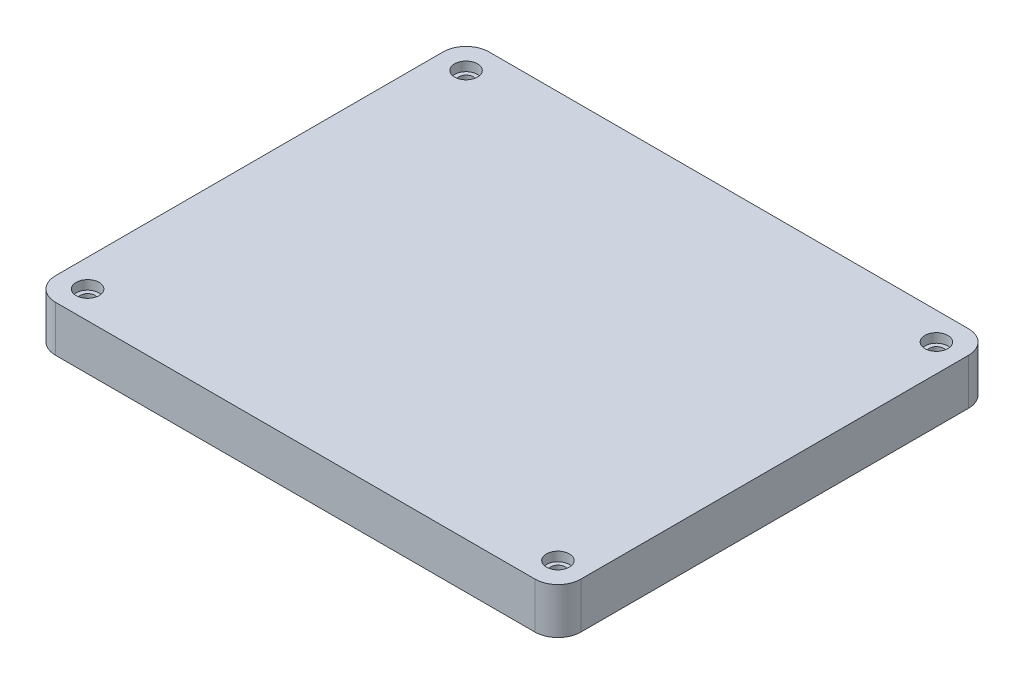
from build123d import *

# Parameters (mm, degrees)
SKETCH1_W            = 114.4
SKETCH1_H            = 94.4
BOSS_EXTRUDE1_DEPTH  = 10
SHELL2_T             = -2
FILLET3_R            = 5
FILLET4_R            = 5
SKETCH5_R            = 4
BOSS_EXTRUDE12_DEPTH = 8
FILLET5_R            = 5
FILLET6_R            = 5
FILLET7_R            = 5
FILLET8_R            = 5
FILLET9_R            = 5
FILLET10_R           = 5
FILLET11_DEPTH       = 9
FILLET12_DEPTH       = 9
SKETCH6_R            = 1.6
CUT_EXTRUDE1_DEPTH   = 10
SKETCH7_R            = 4
BOSS_EXTRUDE13_DEPTH = 10
SKETCH8_R            = 1.5
CUT_EXTRUDE2_DEPTH   = 8
SKETCH9_R            = 2.5
CUT_EXTRUDE3_DEPTH   = 2


with BuildPart() as part:
    # Sketch1 → Boss-Extrude1 (new body)
    with BuildSketch(Plane(origin=(0, 0, 0), x_dir=(1, 0, 0), z_dir=(0, 1, 0))):
        with Locations((57.2, 47.2)):
            Rectangle(SKETCH1_W, SKETCH1_H)
    extrude(amount=BOSS_EXTRUDE1_DEPTH)

    # Shell2
    shell2_openings = [part.faces().sort_by_distance(p)[0] for p in [
        (57.2, 0, -47.2),
    ]]
    offset(amount=SHELL2_T, openings=shell2_openings, kind=Kind.INTERSECTION)

    # Fillet3
    fillet3_edges = [part.edges().sort_by_distance(p)[0] for p in [
        (0, 5, -94.4),
        (114.4, 5, -94.4),
        (114.4, 5, 0),
        (0, 5, 0),
    ]]
    fillet(fillet3_edges, radius=FILLET3_R)

    # Fillet4
    fillet4_edges = [part.edges().sort_by_distance(p)[0] for p in [
        (2, 4, -92.4),
        (2, 4, -2),
        (112.4, 4, -2),
        (112.4, 4, -92.4),
    ]]
    fillet(fillet4_edges, radius=FILLET4_R)

    # Sketch5 → Boss-Extrude12 (add)
    with BuildSketch(Plane(origin=(0, 8, 0), x_dir=(-1, 0, 0), z_dir=(0, -1, 0))):
        with Locations((-108.4, 6)):
            Circle(SKETCH5_R)
        with Locations((-108.4, 88.4)):
            Circle(SKETCH5_R)
        with Locations((-6, 88.4)):
            Circle(SKETCH5_R)
        with Locations((-6, 6)):
            Circle(SKETCH5_R)
    extrude(amount=BOSS_EXTRUDE12_DEPTH)

    # Fillet5
    # the kernel refuses this fillet: 5 mm, written as the material it adds along each edge
    with BuildSketch(Plane(origin=(112.372048604, 0, -6.472048604), x_dir=(-0.783459029597643, 0, -0.6214434398574978), z_dir=(0, 1, 0))) as fillet5_piece_1_section:
        with BuildLine():
            CenterArc((9.160403969, -3.547792862), FILLET5_R, 134.800989095, 83.620629792)
            Line((5.243108821, -6.655010061), (4.851379306, -6.965731781))
            ThreePointArc((4.851379306, -6.965731781), (-0.085536357, -0.74172022), (-0.422348831, -0.26762187))
            Line((-0.422348831, -0.26762187), (0.35232323, 0.354779286))
            ThreePointArc((0.35232323, 0.354779286), (2.818585837, -0.661765711), (5.284848444, 0.354779286))
            Line((5.284848444, 0.354779286), (5.637171673, 0))
        make_face()
    fillet5_piece_1 = extrude(amount=29.180673535, mode=Mode.PRIVATE)
    fillet5_piece_1 = split(fillet5_piece_1, bisect_by=Plane(origin=(112.372048604, 10, -6.472048604), z_dir=(0, -1, 0)), keep=Keep.TOP, mode=Mode.PRIVATE)
    add(fillet5_piece_1)

    # Fillet6
    # the kernel refuses this fillet: 5 mm, written as the material it adds along each edge
    with BuildSketch(Plane(origin=(107.927951396, 0, -2.027951396), x_dir=(-0.6214434398574917, 0, -0.7834590295976479), z_dir=(0, 1, 0))) as fillet6_piece_1_section:
        with BuildLine():
            CenterArc((9.160403969, 3.547792862), FILLET6_R, 141.578381114, 83.620629792)
            Line((5.243108821, 6.655010061), (4.851379306, 6.965731781))
            ThreePointArc((4.851379306, 6.965731781), (-0.085536357, 0.74172022), (-0.422348831, 0.26762187))
            Line((-0.422348831, 0.26762187), (0.35232323, -0.354779286))
            ThreePointArc((0.35232323, -0.354779286), (2.818585837, 0.661765711), (5.284848444, -0.354779286))
            Line((5.284848444, -0.354779286), (5.637171673, 0))
        make_face()
    fillet6_piece_1 = extrude(amount=29.180673535, mode=Mode.PRIVATE)
    fillet6_piece_1 = split(fillet6_piece_1, bisect_by=Plane(origin=(107.927951396, 10, -2.027951396), z_dir=(0, -1, 0)), keep=Keep.TOP, mode=Mode.PRIVATE)
    add(fillet6_piece_1)

    # Fillet7
    # the kernel refuses this fillet: 5 mm, written as the material it adds along each edge
    with BuildSketch(Plane(origin=(112.372048604, 0, -87.927951396), x_dir=(-0.783459029597643, 0, 0.6214434398574978), z_dir=(0, 1, 0))) as fillet7_piece_1_section:
        with BuildLine():
            CenterArc((9.160403969, 3.547792862), FILLET7_R, 141.578381114, 83.620629792)
            Line((5.243108821, 6.655010061), (4.851379306, 6.965731781))
            ThreePointArc((4.851379306, 6.965731781), (-0.085536357, 0.74172022), (-0.422348831, 0.26762187))
            Line((-0.422348831, 0.26762187), (0.35232323, -0.354779286))
            ThreePointArc((0.35232323, -0.354779286), (2.818585837, 0.661765711), (5.284848444, -0.354779286))
            Line((5.284848444, -0.354779286), (5.637171673, 0))
        make_face()
    fillet7_piece_1 = extrude(amount=29.180673535, mode=Mode.PRIVATE)
    fillet7_piece_1 = split(fillet7_piece_1, bisect_by=Plane(origin=(112.372048604, 10, -87.927951396), z_dir=(0, -1, 0)), keep=Keep.TOP, mode=Mode.PRIVATE)
    add(fillet7_piece_1)

    # Fillet8
    # the kernel refuses this fillet: 5 mm, written as the material it adds along each edge
    with BuildSketch(Plane(origin=(107.927951396, 0, -92.372048604), x_dir=(-0.6214434398574917, 0, 0.7834590295976479), z_dir=(0, 1, 0))) as fillet8_piece_1_section:
        with BuildLine():
            CenterArc((9.160403969, -3.547792862), FILLET8_R, 134.800989095, 83.620629792)
            Line((5.243108821, -6.655010061), (4.851379306, -6.965731781))
            ThreePointArc((4.851379306, -6.965731781), (-0.085536357, -0.74172022), (-0.422348831, -0.26762187))
            Line((-0.422348831, -0.26762187), (0.35232323, 0.354779286))
            ThreePointArc((0.35232323, 0.354779286), (2.818585837, -0.661765711), (5.284848444, 0.354779286))
            Line((5.284848444, 0.354779286), (5.637171673, 0))
        make_face()
    fillet8_piece_1 = extrude(amount=29.180673535, mode=Mode.PRIVATE)
    fillet8_piece_1 = split(fillet8_piece_1, bisect_by=Plane(origin=(107.927951396, 10, -92.372048604), z_dir=(0, -1, 0)), keep=Keep.TOP, mode=Mode.PRIVATE)
    add(fillet8_piece_1)

    # Fillet9
    # the kernel refuses this fillet: 5 mm, written as the material it adds along each edge
    with BuildSketch(Plane(origin=(6.472048604, 29.180673535, -2.027951396), x_dir=(0.9999945577477605, 0, 0.003299162751511756), z_dir=(0, -1, 0))) as fillet9_piece_1_section:
        with BuildLine():
            CenterArc((8.4557736, -4.999972789), FILLET9_R, 89.810971555, 83.620629792)
            Line((3.488593561, -4.428026585), (2.991875557, -4.370831965))
            ThreePointArc((2.991875557, -4.370831965), (2.264117061, -1.804476076), (-0.060643809, -0.496308703))
            Line((-0.060643809, -0.496308703), (-0.051154492, 0.497376334))
            ThreePointArc((-0.051154492, 0.497376334), (0.52969032, 0.526206725), (8.473918995, 0.499997279))
            Line((8.473918995, 0.499997279), (8.472269414, 0))
        make_face()
    fillet9_piece_1 = extrude(amount=29.180673535, mode=Mode.PRIVATE)
    fillet9_piece_1 = split(fillet9_piece_1, bisect_by=Plane(origin=(6.472048604, 10, -2.027951396), z_dir=(0, -1, 0)), keep=Keep.TOP, mode=Mode.PRIVATE)
    add(fillet9_piece_1)

    # Fillet10
    # the kernel refuses this fillet: 5 mm, written as the material it adds along each edge
    with BuildSketch(Plane(origin=(2.027951396, 29.180673535, -6.472048604), x_dir=(0.783459029597646, 0, -0.6214434398574942), z_dir=(0, -1, 0))) as fillet10_piece_1_section:
        with BuildLine():
            CenterArc((9.160403969, -3.547792862), FILLET10_R, 134.800989095, 83.620629792)
            Line((5.243108821, -6.655010061), (4.851379306, -6.965731781))
            ThreePointArc((4.851379306, -6.965731781), (-0.085536357, -0.74172022), (-0.422348831, -0.26762187))
            Line((-0.422348831, -0.26762187), (0.35232323, 0.354779286))
            ThreePointArc((0.35232323, 0.354779286), (2.818585837, -0.661765711), (5.284848444, 0.354779286))
            Line((5.284848444, 0.354779286), (5.637171673, 0))
        make_face()
    fillet10_piece_1 = extrude(amount=29.180673535, mode=Mode.PRIVATE)
    fillet10_piece_1 = split(fillet10_piece_1, bisect_by=Plane(origin=(2.027951396, 10, -6.472048604), z_dir=(0, -1, 0)), keep=Keep.TOP, mode=Mode.PRIVATE)
    add(fillet10_piece_1)

    # Fillet11: read off the stored shape, not the designer's step
    # Fillet11 outline → Fillet11 (add)
    with BuildSketch(Plane(origin=(0, 0, 0), x_dir=(1, 0, 0), z_dir=(0, 1, 0))):
        with BuildLine():
            ThreePointArc((2, 79.45572809), (3.273220038, 82.789061423), (6.444444444, 84.42476804))
            ThreePointArc((6.444444444, 84.42476804), (3.51422624, 85.266163882), (2.027951396, 87.927951396))
            ThreePointArc((2.027951396, 87.927951396), (2.006992739, 87.664345398), (2, 87.4))
            Line((2, 87.4), (2, 79.45572809))
        make_face()
    extrude(amount=FILLET11_DEPTH)

    # Fillet12: read off the stored shape, not the designer's step
    # Fillet12 outline → Fillet12 (add)
    with BuildSketch(Plane(origin=(0, 0, 0), x_dir=(1, 0, 0), z_dir=(0, 1, 0))):
        with BuildLine():
            ThreePointArc((9.97523196, 87.955555556), (11.610938577, 91.126779962), (14.94427191, 92.4))
            Line((14.94427191, 92.4), (7, 92.4))
            ThreePointArc((7, 92.4), (6.735654602, 92.393007261), (6.472048604, 92.372048604))
            ThreePointArc((6.472048604, 92.372048604), (9.133836118, 90.88577376), (9.97523196, 87.955555556))
        make_face()
    extrude(amount=FILLET12_DEPTH)

    # Sketch6 → Cut-Extrude1 (cut)
    with BuildSketch(Plane(origin=(0, 0, 0), x_dir=(-1, 0, 0), z_dir=(0, -1, 0))):
        with Locations(Location((-6, 6, 0), (0, 0, 90))):
            Circle(SKETCH6_R)
        with Locations(Location((-108.4, 88.4, 0), (0, 0, 90))):
            Circle(SKETCH6_R)
        with Locations(Location((-108.4, 6, 0), (0, 0, 90))):
            Circle(SKETCH6_R)
        with Locations(Location((-6, 88.4, 0), (0, 0, 90))):
            Circle(SKETCH6_R)
    extrude(amount=-CUT_EXTRUDE1_DEPTH, mode=Mode.SUBTRACT)

    # Sketch7 → Boss-Extrude13 (add)
    with BuildSketch(Plane(origin=(0, 8, 0), x_dir=(-1, 0, 0), z_dir=(0, -1, 0))):
        with Locations(Location((-96.5, 19.1, 0), (0, 0, 90))):
            Circle(SKETCH7_R)
        with Locations(Location((-17, 19.1, 0), (0, 0, 90))):
            Circle(SKETCH7_R)
        with Locations(Location((-96.5, 77.4, 0), (0, 0, 90))):
            Circle(SKETCH7_R)
        with Locations(Location((-17, 77.4, 0), (0, 0, 90))):
            Circle(SKETCH7_R)
    extrude(amount=BOSS_EXTRUDE13_DEPTH)

    # Sketch8 → Cut-Extrude2 (cut)
    with BuildSketch(Plane(origin=(0, -2, 0), x_dir=(-1, 0, 0), z_dir=(0, -1, 0))):
        with Locations(Location((-17, 19.1, 0), (0, 0, 90))):
            Circle(SKETCH8_R)
        with Locations(Location((-96.5, 19.1, 0), (0, 0, 90))):
            Circle(SKETCH8_R)
        with Locations(Location((-96.5, 77.4, 0), (0, 0, 90))):
            Circle(SKETCH8_R)
        with Locations(Location((-17, 77.4, 0), (0, 0, 90))):
            Circle(SKETCH8_R)
    extrude(amount=-CUT_EXTRUDE2_DEPTH, mode=Mode.SUBTRACT)

    # Sketch9 → Cut-Extrude3 (cut)
    with BuildSketch(Plane(origin=(0, 10, 0), x_dir=(1, 0, 0), z_dir=(0, 1, 0))):
        with Locations(Location((6, 88.4, 0), (0, 0, 270))):
            Circle(SKETCH9_R)
        with Locations(Location((6, 6, 0), (0, 0, 270))):
            Circle(SKETCH9_R)
        with Locations(Location((108.4, 6, 0), (0, 0, 270))):
            Circle(SKETCH9_R)
        with Locations(Location((108.4, 88.4, 0), (0, 0, 270))):
            Circle(SKETCH9_R)
    extrude(amount=-CUT_EXTRUDE3_DEPTH, mode=Mode.SUBTRACT)


solid = part.part
